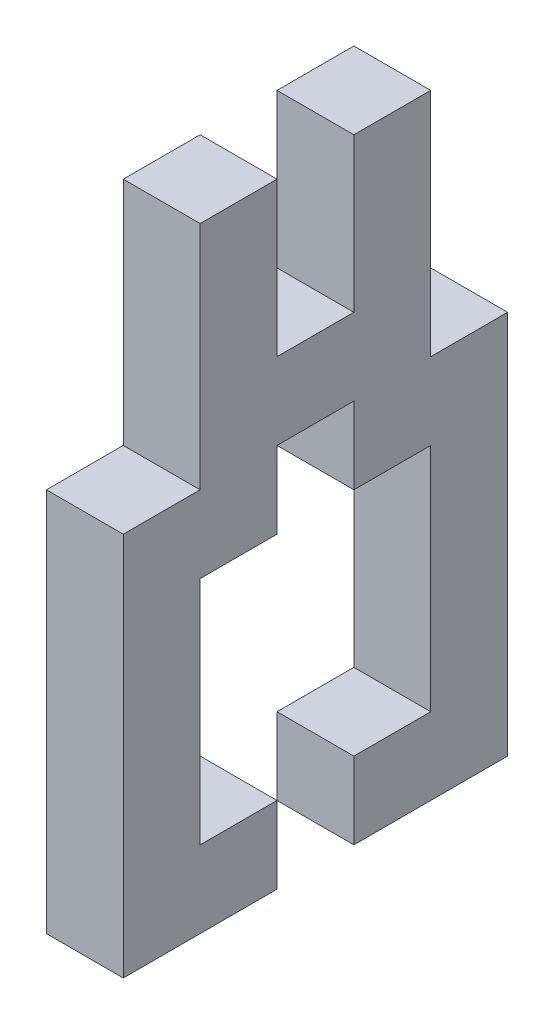
from build123d import *

# Parameters (mm, degrees)
BOSS_EXTRUDE1_DEPTH = 6.35


with BuildPart() as part:
    # Sketch2 → Boss-Extrude1 (new body)
    with BuildSketch(Plane(origin=(0, 0, 0), x_dir=(0, 0, -1), z_dir=(1, 0, 0))):
        Polygon((12.7, 38.1), (12.7, 50.8), (6.35, 50.8), (6.35, 31.75), (0, 31.75), (0, 0), (12.7, 0), (12.7, 6.35), (6.35, 6.35), (6.35, 25.4), (12.7, 25.4), (12.7, 31.75), (19.05, 31.75), (19.05, 25.4), (25.4, 25.4), (25.4, 6.35), (19.05, 6.35), (19.05, 0), (31.75, 0), (31.75, 31.75), (25.4, 31.75), (25.4, 50.8), (19.05, 50.8), (19.05, 38.1), align=None)
    extrude(amount=BOSS_EXTRUDE1_DEPTH)


solid = part.part
